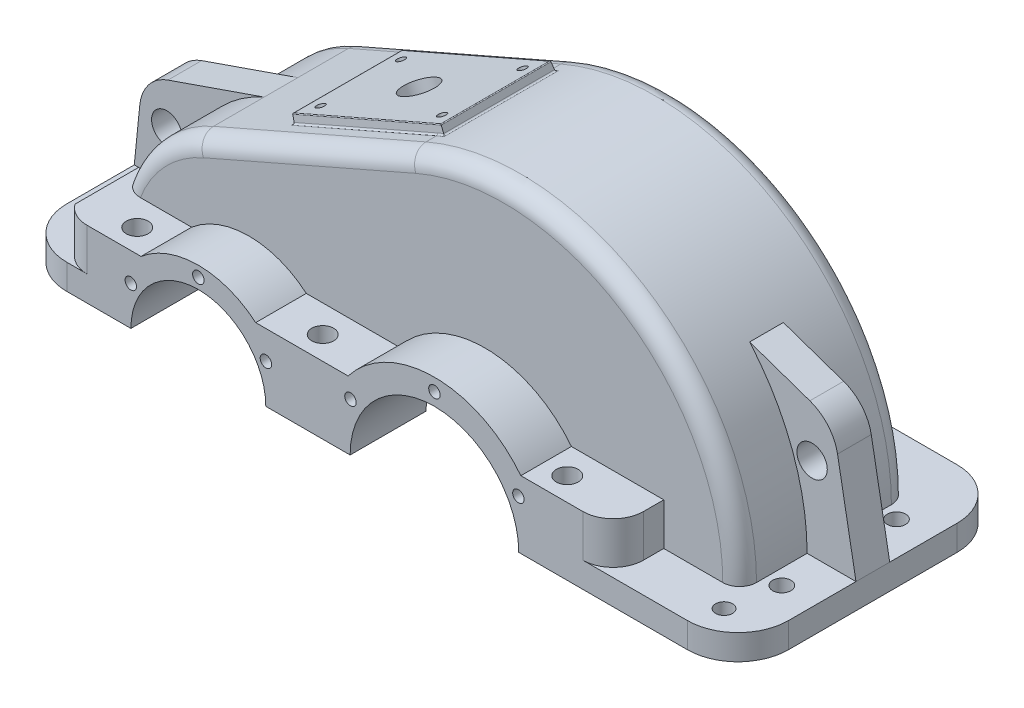
from build123d import *

# Parameters (mm, degrees)
EXTRUDE_1_DEPTH          = 50
FILLET_1_R               = 10
EXTRUDE_4_DEPTH          = 15
SHELL_START              = -35
SHELL_4_DEPTH            = 70
EXTRUDE_5_DEPTH          = 45
EXTRUDE_6_DEPTH          = 40
SKETCH_9_R               = 50
SKETCH_9_R_2             = 40
CUT_EXTRUDE_1_DEPTH      = 60
SKETCH_12_R              = 5.4
CUT_EXTRUDE_2_DEPTH      = 358.436707835
SKETCH_14_R              = 6.5
CUT_EXTRUDE_4_DEPTH      = 349.404936967
SKETCH_15_R              = 5
CUT_EXTRUDE_5_DEPTH      = 358.436707835
PATTERN_CIRCULAR_1_COUNT = 6
PATTERN_CIRCULAR_2_COUNT = 6
RIB_1_DEPTH              = 10
RIB_3_DEPTH              = 10
SKETCH_26_R              = 9
CUT_EXTRUDE_6_DEPTH      = 360.806892805
SKETCH_28_R              = 9
CUT_EXTRUDE_7_DEPTH      = 360.806892805
EXTRUDE_13_REACH         = 375.685
SKETCH_30_W              = 96
SKETCH_30_H              = 65
EXTRUDE_13_DRAFT         = 5
FILLET_4_R               = 0.5
FILLET_5_R               = 1
SKETCH_33_R              = 10
CUT_EXTRUDE_10_DEPTH     = 374.684510906
SKETCH_47_R              = 5
CUT_EXTRUDE_11_DEPTH     = 358.436707835
EXTRUDE_14_DEPTH         = 70
CUT_EXTRUDE_12_DEPTH     = 70


# Read off the part's stored shape, not the designer's step: 抽壳4, 筋1, 筋3
with BuildPart() as part:
    # 草图1 → 凸台-拉伸1 (new, symmetric)
    with BuildSketch(Plane.XY):
        with BuildLine():
            Line((-32, 73.321211119), (94, 128.312119459))
            ThreePointArc((94, 128.312119459), (226.681158051, 117.132403715), (290, 0))
            Line((290, 0), (-80, 0))
            ThreePointArc((-80, 0), (-66.932802123, 43.8178046), (-32, 73.321211119))
        make_face()
    extrude(amount=EXTRUDE_1_DEPTH, both=True)

    # 圆角1
    fillet_1_edges = [part.edges().sort_by_distance(p)[0] for p in [
        (226.681158051, 117.132403715, 50),
        (31, 100.816665289, 50),
        (-66.932802123, 43.8178046, 50),
        (31, 100.816665289, -50),
        (226.681158051, 117.132403715, -50),
        (-66.932802123, 43.8178046, -50),
    ]]
    fillet(fillet_1_edges, radius=FILLET_1_R)

    # 草图3 → 凸台-拉伸4 (add)
    with BuildSketch(Plane.XZ):
        with BuildLine():
            Line((-79, -80), (289, -80))
            ThreePointArc((289, -80), (310.213203436, -71.213203436), (319, -50))
            Line((319, -50), (319, 50))
            ThreePointArc((319, 50), (310.213203436, 71.213203436), (289, 80))
            Line((289, 80), (-79, 80))
            ThreePointArc((-79, 80), (-100.213203436, 71.213203436), (-109, 50))
            Line((-109, 50), (-109, -50))
            ThreePointArc((-109, -50), (-100.213203436, -71.213203436), (-79, -80))
        make_face()
    extrude(amount=EXTRUDE_4_DEPTH)

    # 抽壳4 outline → 抽壳4 (cut)
    with BuildSketch(Plane.XY.offset(SHELL_START)):
        with BuildLine():
            ThreePointArc((-26, 59.573484034), (-58.150608956, 29.043186432), (-63.245553203, -15))
            Line((-63.245553203, -15), (274.09673646, -15))
            ThreePointArc((274.09673646, -15), (224.627840189, 100.27804081), (100, 114.564392374))
            Line((100, 114.564392374), (-26, 59.573484034))
        make_face()
    extrude(amount=SHELL_4_DEPTH, mode=Mode.SUBTRACT)

    # 草图6 → 凸台-拉伸5 (add)
    with BuildSketch(Plane(origin=(0, 0, 35), x_dir=(-1, 0, 0), z_dir=(0, 0, -1))):
        with BuildLine():
            Line((53.5, -15), (-51.5, -15))
            ThreePointArc((-51.5, -15), (1, 37.5), (53.5, -15))
        make_face()
        with BuildLine():
            Line((-74, -15), (-204, -15))
            ThreePointArc((-204, -15), (-139, 50), (-74, -15))
        make_face()
    extrude_5 = extrude(amount=-EXTRUDE_5_DEPTH)

    # 草图8 → 凸台-拉伸6 (add)
    with BuildSketch(Plane.XZ.offset(15)):
        with BuildLine():
            Line((-67, 80), (227, 80))
            ThreePointArc((227, 80), (239.727922061, 74.727922061), (245, 62))
            Line((245, 62), (245, 35))
            Line((245, 35), (-85, 35))
            Line((-85, 35), (-85, 62))
            ThreePointArc((-85, 62), (-79.727922061, 74.727922061), (-67, 80))
        make_face()
    extrude_6 = extrude(amount=-EXTRUDE_6_DEPTH)

    # 草图9 → 切除-拉伸1 (cut)
    with BuildSketch(Plane.XY.offset(80)):
        with Locations((139, -15)):
            Circle(SKETCH_9_R)
        with Locations((-1, -15)):
            Circle(SKETCH_9_R_2)
    cut_extrude_1 = extrude(amount=-CUT_EXTRUDE_1_DEPTH, mode=Mode.SUBTRACT)

    # 草图12 → 切除-拉伸2 (cut, through all)
    with BuildSketch(Plane(origin=(0, 0, 0), x_dir=(-1, 0, 0), z_dir=(0, 1, 0))):
        with Locations(Location((-299, 34, 0), (0, 0, 90))):
            Circle(SKETCH_12_R)
    cut_extrude_2 = extrude(amount=-CUT_EXTRUDE_2_DEPTH, mode=Mode.SUBTRACT)

    # 草图14 → 切除-拉伸4 (cut, through all)
    with BuildSketch(Plane(origin=(0, 25, 0), x_dir=(1, 0, 0), z_dir=(0, 1, 0))):
        with Locations(Location((204, -66.247, 0), (0, 0, 270))):
            Circle(SKETCH_14_R)
        with Locations(Location((59, -66.247, 0), (0, 0, 270))):
            Circle(SKETCH_14_R)
        with Locations(Location((-51, -66.247, 0), (0, 0, 270))):
            Circle(SKETCH_14_R)
    cut_extrude_4 = extrude(amount=-CUT_EXTRUDE_4_DEPTH, mode=Mode.SUBTRACT)

    # 草图15 → 切除-拉伸5 (cut, through all)
    with BuildSketch(Plane(origin=(0, 0, 0), x_dir=(1, 0, 0), z_dir=(0, 1, 0))):
        with Locations(Location((-88.5, -34, 0), (0, 0, 270))):
            Circle(SKETCH_15_R)
    cut_extrude_5 = extrude(amount=-CUT_EXTRUDE_5_DEPTH, mode=Mode.SUBTRACT)

    # 草图18 → M8 螺纹孔1 (revolve, cut)
    with BuildSketch(Plane(origin=(-1, 31.25, 80), x_dir=(0, -1, 0), z_dir=(1, 0, 0))):
        Polygon((0, 0), (0, 22.042926105), (3.4, 20), (3.4, 0), align=None)
    hole_wizard_m8_1 = revolve(axis=Axis((-1, 31.25, 86.35), (0, 0, -1)), mode=Mode.SUBTRACT)

    # 阵列(圆周)1: M8 螺纹孔1 ×6 about axis, 3 skipped
    pattern_circular_1_axis = Axis((-1, -15, 0), (0, 0, 1))
    add([hole_wizard_m8_1.rotate(pattern_circular_1_axis, i * 360 / PATTERN_CIRCULAR_1_COUNT) for i in range(1, PATTERN_CIRCULAR_1_COUNT) if i not in (2, 3, 4)], mode=Mode.SUBTRACT)

    # 草图21 → M8 螺纹孔2 (revolve, cut)
    with BuildSketch(Plane(origin=(139, 42.5, 80), x_dir=(0, -1, 0), z_dir=(1, 0, 0))):
        Polygon((0, 0), (0, 22.042926105), (3.4, 20), (3.4, 0), align=None)
    hole_wizard_m8_2 = revolve(axis=Axis((139, 42.5, 86.35), (0, 0, -1)), mode=Mode.SUBTRACT)

    # 阵列(圆周)2: M8 螺纹孔2 ×6 about axis, 3 skipped
    pattern_circular_2_axis = Axis((139, -15, 0), (0, 0, -1))
    add([hole_wizard_m8_2.rotate(pattern_circular_2_axis, i * 360 / PATTERN_CIRCULAR_2_COUNT) for i in range(1, PATTERN_CIRCULAR_2_COUNT) if i not in (2, 3, 4)], mode=Mode.SUBTRACT)

    # 筋1 outline → 筋1 (add)
    with BuildSketch(Plane.XY):
        with BuildLine():
            ThreePointArc((-80, 0), (-66.932802123, 43.8178046), (-32, 73.321211119))
            Line((-32, 73.321211119), (-89.046018616, 53.540385168))
            ThreePointArc((-89.046018616, 53.540385168), (-100.470326199, 45.420555348), (-105.729456424, 32.428712163))
            Line((-105.729456424, 32.428712163), (-109, 0))
            Line((-109, 0), (-80, 0))
        make_face()
    rib_1 = extrude(amount=RIB_1_DEPTH)

    # 筋3 outline → 筋3 (add)
    with BuildSketch(Plane.XY):
        with BuildLine():
            Line((291.638002483, 79.173127597), (255.929837738, 91.536164858))
            ThreePointArc((255.929837738, 91.536164858), (281.206282783, 48.835554245), (290, 0))
            Line((290, 0), (319, 0))
            Line((319, 0), (308.053218407, 60.033647137))
            ThreePointArc((308.053218407, 60.033647137), (302.435291444, 71.824459818), (291.638002483, 79.173127597))
        make_face()
    rib_3 = extrude(amount=RIB_3_DEPTH)

    # 草图26 → 切除-拉伸6 (cut, through all)
    with BuildSketch(Plane.XY.offset(10)):
        with Locations((-89.734801096, 28.450258949)):
            Circle(SKETCH_26_R)
    cut_extrude_6 = extrude(amount=-CUT_EXTRUDE_6_DEPTH, mode=Mode.SUBTRACT)

    # 草图28 → 切除-拉伸7 (cut, through all)
    with BuildSketch(Plane.XY.offset(10)):
        with Locations((292.967817078, 49.081250048)):
            Circle(SKETCH_28_R)
    cut_extrude_7 = extrude(amount=-CUT_EXTRUDE_7_DEPTH, mode=Mode.SUBTRACT)

    # 镜向4: 凸台-拉伸5, 凸台-拉伸6, 切除-拉伸1, 切除-拉伸2, 切除-拉伸4, 切除-拉伸5, M8 螺纹孔1, M8 螺纹孔2, 筋1, 筋3, 切除-拉伸6, 切除-拉伸7 across plane
    add(extrude_5.mirror(Plane.XY))
    add(extrude_6.mirror(Plane.XY))
    add(cut_extrude_1.mirror(Plane.XY), mode=Mode.SUBTRACT)
    add(cut_extrude_2.mirror(Plane.XY), mode=Mode.SUBTRACT)
    add(cut_extrude_4.mirror(Plane.XY), mode=Mode.SUBTRACT)
    add(cut_extrude_5.mirror(Plane.XY), mode=Mode.SUBTRACT)
    add(hole_wizard_m8_1.mirror(Plane.XY), mode=Mode.SUBTRACT)
    add(hole_wizard_m8_2.mirror(Plane.XY), mode=Mode.SUBTRACT)
    add(rib_1.mirror(Plane.XY))
    add(rib_3.mirror(Plane.XY))
    add(cut_extrude_6.mirror(Plane.XY), mode=Mode.SUBTRACT)
    add(cut_extrude_7.mirror(Plane.XY), mode=Mode.SUBTRACT)

    # 镜向4 copy 1 sketch → 镜向4 copy 1 (revolve, cut)
    with BuildSketch(Plane(origin=(-41.053674925, 8.125, -80), x_dir=(0.8660254037844386, -0.5000000000000001, 0), z_dir=(0.5000000000000001, 0.8660254037844386, 0))):
        Polygon((0, 0), (0, -22.042926105), (3.4, -20), (3.4, 0), align=None)
    revolve(axis=Axis((-41.053674925, 8.125, -86.35), (0, 0, -1)), mode=Mode.SUBTRACT)

    # 镜向4 copy 2 sketch → 镜向4 copy 2 (revolve, cut)
    with BuildSketch(Plane(origin=(39.053674925, 8.125, -80), x_dir=(-0.8660254037844386, -0.5000000000000001, 0), z_dir=(0.5000000000000001, -0.8660254037844386, 0))):
        Polygon((0, 0), (0, -22.042926105), (3.4, -20), (3.4, 0), align=None)
    revolve(axis=Axis((39.053674925, 8.125, -86.35), (0, 0, -1)), mode=Mode.SUBTRACT)

    # 镜向4 copy 3 sketch → 镜向4 copy 3 (revolve, cut)
    with BuildSketch(Plane(origin=(188.796460718, 13.75, -80), x_dir=(-0.8660254037844386, -0.5000000000000001, 0), z_dir=(0.5000000000000001, -0.8660254037844386, 0))):
        Polygon((0, 0), (0, -22.042926105), (3.4, -20), (3.4, 0), align=None)
    revolve(axis=Axis((188.796460718, 13.75, -86.35), (0, 0, -1)), mode=Mode.SUBTRACT)

    # 镜向4 copy 4 sketch → 镜向4 copy 4 (revolve, cut)
    with BuildSketch(Plane(origin=(89.203539282, 13.75, -80), x_dir=(0.8660254037844386, -0.5000000000000001, 0), z_dir=(0.5000000000000001, 0.8660254037844386, 0))):
        Polygon((0, 0), (0, -22.042926105), (3.4, -20), (3.4, 0), align=None)
    revolve(axis=Axis((89.203539282, 13.75, -86.35), (0, 0, -1)), mode=Mode.SUBTRACT)




with BuildPart() as extrude_13_long_prism_1:
    # 草图30 → 凸台-拉伸13 (the long prism of profile 1, to be tilted and cut off)
    with BuildSketch(Plane(origin=(-34, 77.903786814, 0), x_dir=(-0.916515138991168, -0.4, 0), z_dir=(-0.4, 0.916515138991168, 0))):
        with Locations((-93.138097294, 0)):
            Rectangle(SKETCH_30_W, SKETCH_30_H)
    extrude(amount=-EXTRUDE_13_REACH)
    extrude_13_tool1_sides = [extrude_13_long_prism_1.faces().sort_by_distance(p)[0] for p in [
        (126.499476187, -57.001469264, 32.5),
        (82.506749516, -76.201469264, 0),
        (126.499476187, -57.001469264, -32.5),
        (170.492202859, -37.801469264, 0),
    ]]
    draft(extrude_13_tool1_sides, Plane(origin=(-34, 77.903786814, 0), x_dir=(-0.916515138991168, -0.4, 0), z_dir=(-0.4, 0.916515138991168, 0)), EXTRUDE_13_DRAFT)  # the draft: side faces tilted about the start plane


with BuildPart() as part_1:
    add(part.part)
    extrude_13_tool1 = extrude_13_long_prism_1.part - part.part
    add(extrude_13_tool1.solids().sort_by_distance((51.362476, 115.159026, 0))[0])

    # 圆角4
    fillet_4_edges = [part_1.edges().sort_by_distance(p)[0] for p in [
        (7.369749516, 95.959025732, 0),
        (51.362476187, 115.159025732, 32.5),
        (95.355202859, 134.359025732, 0),
        (51.362476187, 115.159025732, -32.5),
    ]]
    fillet(fillet_4_edges, radius=FILLET_4_R)

    # 圆角5
    fillet_5_edges = [part_1.edges().sort_by_distance(p)[0] for p in [
        (8.968826093, 91.20147271, 0),
        (51.484413046, 109.756796084, -32.937443318),
        (97.785010413, 129.898402078, 0),
        (51.484413046, 109.756796084, 32.937443318),
    ]]
    fillet(fillet_5_edges, radius=FILLET_5_R)

    # 草图33 → 切除-拉伸10 (cut, through all)
    with BuildSketch(Plane(origin=(-34, 77.903786814, 0), x_dir=(0.9165151389911681, 0.3999999999999999, 0), z_dir=(-0.39999999999999986, 0.916515138991168, 0))):
        with Locations(Location((91.536766865, 0, 0), (0, 0, 180))):
            Circle(SKETCH_33_R)
    extrude(amount=-CUT_EXTRUDE_10_DEPTH, mode=Mode.SUBTRACT)

    # 草图42 → M6 螺纹孔2 (revolve, cut)
    with BuildSketch(Plane(origin=(15.306539817, 99.422925002, -23.840251826), x_dir=(-0.9165151389911681, -0.3999999999999999, 0), z_dir=(0, 0, 1))):
        Polygon((0, 0), (0, 16.502151548), (2.5, 15), (2.5, 0), align=None)
    hole_wizard_m6_2 = revolve(axis=Axis((12.766539817, 105.242796134, -23.840251826), (0.39999999999999997, -0.9165151389911681, 0)), mode=Mode.SUBTRACT)

    # 草图44 → M6 螺纹孔3 (revolve, cut)
    with BuildSketch(Plane(origin=(87.418412558, 130.895126462, -23.840251826), x_dir=(-0.9165151389911681, -0.3999999999999999, 0), z_dir=(0, 0, 1))):
        Polygon((0, 0), (0, 16.502151548), (2.5, 15), (2.5, 0), align=None)
    hole_wizard_m6_3 = revolve(axis=Axis((84.878412558, 136.714997595, -23.840251826), (0.39999999999999997, -0.9165151389911681, 0)), mode=Mode.SUBTRACT)

    # 镜向6: M6 螺纹孔2, M6 螺纹孔3 across plane
    add(hole_wizard_m6_2.mirror(Plane.XY), mode=Mode.SUBTRACT)
    add(hole_wizard_m6_3.mirror(Plane.XY), mode=Mode.SUBTRACT)

    # 草图47 → 切除-拉伸11 (cut, through all)
    with BuildSketch(Plane(origin=(0, 0, 0), x_dir=(1, 0, 0), z_dir=(0, 1, 0))):
        with Locations(Location((293.75022383, -63, 0), (0, 0, 270))):
            Circle(SKETCH_47_R)
    extrude(amount=-CUT_EXTRUDE_11_DEPTH, mode=Mode.SUBTRACT)

    # 草图53 → 凸台-拉伸14 (add)
    with BuildSketch(Plane.XY.offset(-35)):
        with BuildLine():
            Line((-26, 59.573484034), (-59.899859727, 45.835237934))
            Line((-59.899859727, 45.835237934), (-80.066470418, -15))
            Line((-80.066470418, -15), (-41, -15))
            ThreePointArc((-41, -15), (-43.759299187, 24.350337272), (-26, 59.573484034))
        make_face()
    extrude(amount=EXTRUDE_14_DEPTH)

    # 草图54 → 切除-拉伸12 (cut)
    with BuildSketch(Plane.XY.offset(-35)):
        with BuildLine():
            Line((100, 114.564392374), (187.660254038, -15))
            Line((187.660254038, -15), (280, -15))
            ThreePointArc((280, -15), (224.365076065, 97.52458573), (100, 114.564392374))
        make_face()
    extrude(amount=CUT_EXTRUDE_12_DEPTH, mode=Mode.SUBTRACT)


solid = part_1.part
